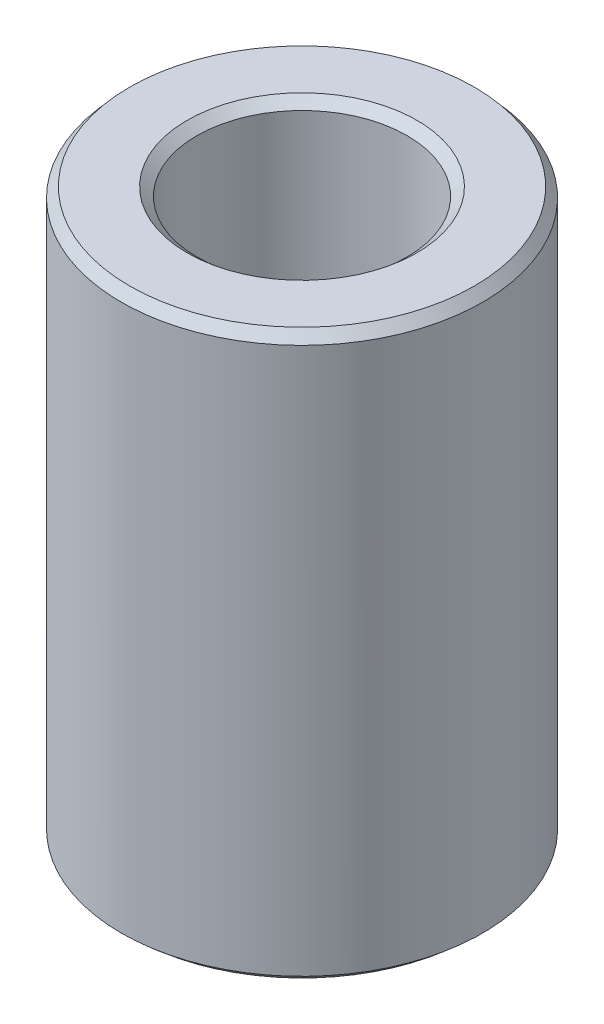
from build123d import *
from OCP.BRepFilletAPI import BRepFilletAPI_MakeChamfer

# Parameters (mm, degrees)
SKETCH1_R           = 15
BOSS_EXTRUDE1_DEPTH = 46.86259274
SKETCH2_R           = 8.723256417
CUT_EXTRUDE1_DEPTH  = 52.440281865
CHAMFER1_SIZE       = 0.811363004
CHAMFER1_SIZE2      = 0.698088611


with BuildPart() as part:
    # Sketch1 → Boss-Extrude1 (new body)
    with BuildSketch(Plane(origin=(0, 0, 0), x_dir=(1, 0, 0), z_dir=(0, 1, 0))):
        Circle(SKETCH1_R)
    extrude(amount=BOSS_EXTRUDE1_DEPTH)

    # Sketch2 → Cut-Extrude1 (cut, through all)
    with BuildSketch(Plane(origin=(0, 0, 0), x_dir=(1, 0, 0), z_dir=(0, 1, 0))):
        Circle(SKETCH2_R)
    extrude(amount=CUT_EXTRUDE1_DEPTH, mode=Mode.SUBTRACT)

    # Chamfer1: one chamfer whose edges measure the first distance from different faces: ONE call of the kernel's chamfer builder (chamfer() names one face for all edges)
    chamfer1_edges_1 = [part.edges().sort_by_distance(p)[0] for p in [
        (-8.723256417, 46.86259274, 0),
    ]]
    chamfer1_side_1 = [part.faces().sort_by_distance(p)[0] for p in [
        (-14.575735931, 46.86259274, 0),
    ]]
    chamfer1_edges_2 = [part.edges().sort_by_distance(p)[0] for p in [
        (-8.723256417, 0, 0),
    ]]
    chamfer1_side_2 = [part.faces().sort_by_distance(p)[0] for p in [
        (-8.723256417, 23.43129637, 0),
    ]]
    chamfer1_edges_3 = [part.edges().sort_by_distance(p)[0] for p in [
        (-15, 0, 0),
    ]]
    chamfer1_side_3 = [part.faces().sort_by_distance(p)[0] for p in [
        (-14.575735931, 0, 0),
    ]]
    chamfer1_edges_4 = [part.edges().sort_by_distance(p)[0] for p in [
        (-15, 46.86259274, 0),
    ]]
    chamfer1_side_4 = [part.faces().sort_by_distance(p)[0] for p in [
        (-15, 23.43129637, 0),
    ]]
    chamfer1 = BRepFilletAPI_MakeChamfer(part.part.solid().wrapped)
    for e in chamfer1_edges_1:
        chamfer1.Add(CHAMFER1_SIZE, CHAMFER1_SIZE2, e.wrapped, chamfer1_side_1[0].wrapped)  # the first distance lies on this face
    for e in chamfer1_edges_2:
        chamfer1.Add(CHAMFER1_SIZE, CHAMFER1_SIZE2, e.wrapped, chamfer1_side_2[0].wrapped)  # the first distance lies on this face
    for e in chamfer1_edges_3:
        chamfer1.Add(CHAMFER1_SIZE, CHAMFER1_SIZE2, e.wrapped, chamfer1_side_3[0].wrapped)  # the first distance lies on this face
    for e in chamfer1_edges_4:
        chamfer1.Add(CHAMFER1_SIZE, CHAMFER1_SIZE2, e.wrapped, chamfer1_side_4[0].wrapped)  # the first distance lies on this face
    add(Compound.cast(chamfer1.Shape()), mode=Mode.REPLACE)


solid = part.part
